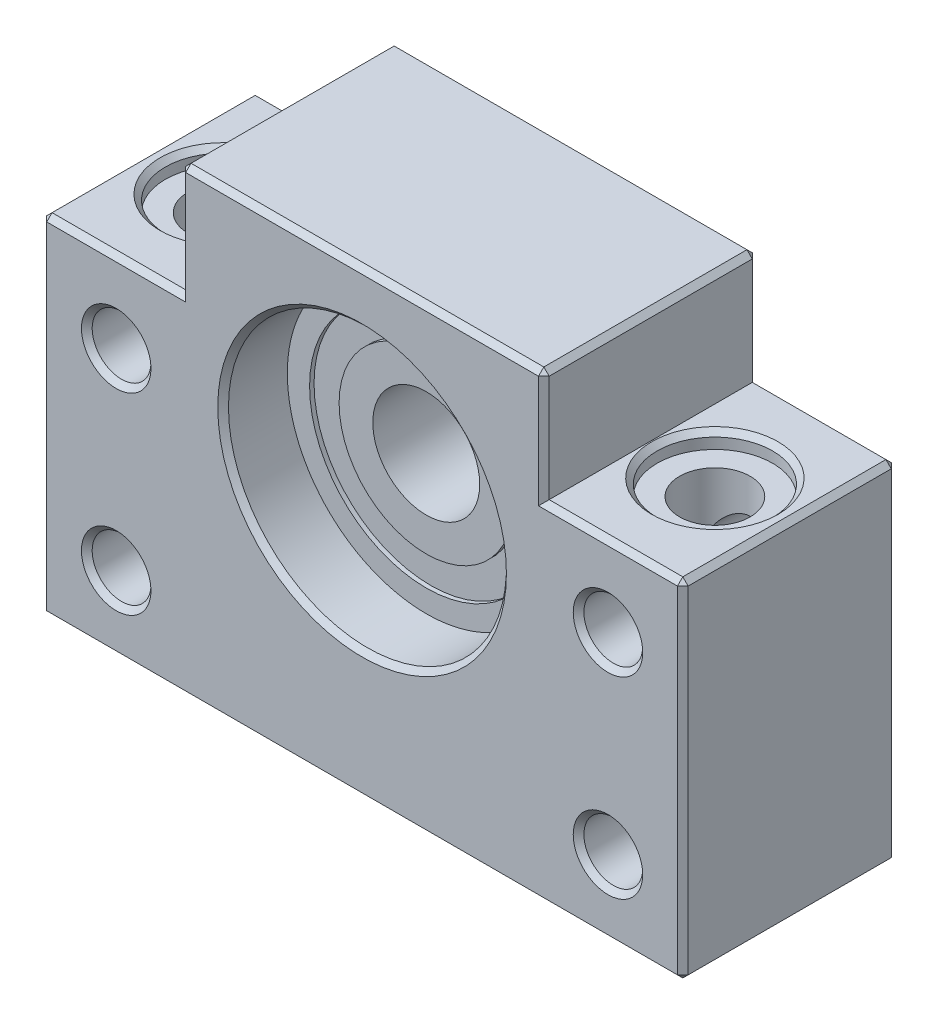
from build123d import *

# Parameters (mm, degrees)
SKETCH1_R           = 13
BOSS_EXTRUDE1_DEPTH = 10
SKETCH2_R           = 2.75
CUT_EXTRUDE1_DEPTH  = 44.874821937
SKETCH3_R           = 3.3
CUT_EXTRUDE2_DEPTH  = 46.345892868
SKETCH4_R           = 5.4
CUT_EXTRUDE3_DEPTH  = 1.5
CHAMFER1_SIZE       = 0.5


with BuildPart() as part:
    # Sketch1 → Boss-Extrude1 (new, symmetric)
    with BuildSketch(Plane.XY):
        Polygon((17, 18), (-17, 18), (-17, 7.5), (-30, 7.5), (-30, -25), (30, -25), (30, 7.5), (17, 7.5), align=None)
        Circle(SKETCH1_R, mode=Mode.SUBTRACT)
    extrude(amount=BOSS_EXTRUDE1_DEPTH, both=True)

    # Sketch2 → Cut-Extrude1 (cut, through all)
    with BuildSketch(Plane.XY.offset(10)):
        with Locations((-23, 0)):
            Circle(SKETCH2_R)
        with Locations((-23, -18)):
            Circle(SKETCH2_R)
        with Locations((23, -18)):
            Circle(SKETCH2_R)
        with Locations((23, 0)):
            Circle(SKETCH2_R)
    extrude(amount=-CUT_EXTRUDE1_DEPTH, mode=Mode.SUBTRACT)

    # Sketch3 → Cut-Extrude2 (cut, through all)
    with BuildSketch(Plane(origin=(0, 7.5, 0), x_dir=(1, 0, 0), z_dir=(0, 1, 0))):
        with Locations((-23, 0)):
            Circle(SKETCH3_R)
        with Locations((23, 0)):
            Circle(SKETCH3_R)
    extrude(amount=-CUT_EXTRUDE2_DEPTH, mode=Mode.SUBTRACT)

    # Sketch4 → Cut-Extrude3 (cut)
    with BuildSketch(Plane(origin=(0, 7.5, 0), x_dir=(1, 0, 0), z_dir=(0, 1, 0))):
        with Locations((-23, 0)):
            Circle(SKETCH4_R)
        with Locations((23, 0)):
            Circle(SKETCH4_R)
    extrude(amount=-CUT_EXTRUDE3_DEPTH, mode=Mode.SUBTRACT)

    # Chamfer1
    chamfer1_edges = [part.edges().sort_by_distance(p)[0] for p in [
        (-13, 0, -10),
        (-25.75, 0, -10),
        (20.25, 0, -10),
        (20.25, -18, -10),
        (-25.75, -18, -10),
        (-13, 0, 10),
        (30, -25, 0),
        (30, 7.5, 0),
        (17, 18, 0),
        (-17, 18, 0),
        (-30, 7.5, 0),
        (-23.5, 7.5, -10),
        (-30, -8.75, -10),
        (-17, 12.75, -10),
        (0, 18, -10),
        (17, 12.75, -10),
        (23.5, 7.5, -10),
        (30, -8.75, -10),
        (0, -25, -10),
        (-30, -25, 0),
        (0, 18, 10),
        (17, 12.75, 10),
        (23.5, 7.5, 10),
        (30, -8.75, 10),
        (0, -25, 10),
        (-30, -8.75, 10),
        (-23.5, 7.5, 10),
        (-17, 12.75, 10),
        (-25.75, 0, 10),
        (20.25, 0, 10),
        (20.25, -18, 10),
        (-25.75, -18, 10),
        (17.6, 7.5, 0),
        (-28.4, 7.5, 0),
    ]]
    chamfer(chamfer1_edges, length=CHAMFER1_SIZE)


with BuildPart() as body_2:
    # Sketch5 → Revolve1 (revolve)
    with BuildSketch(Plane(origin=(0, 0, 0), x_dir=(1, 0, 0), z_dir=(0, 1, 0))):
        Polygon((-13, 4), (-10.911412894, 4), (-10.911412894, 3.582423173), (-8.151084393, 3.582423173), (-8.151084393, 4), (-5, 4), (-5, 0), (-13, 0), align=None)
    revolve(axis=Axis((0, 0, 0), (0, 0, -1)))

    # Mirror2: body 2 across plane


with BuildPart() as body_2_1:
    add(body_2.part)
    add(body_2.part.mirror(Plane(origin=(-13, 0, 0), x_dir=(1, 0, 0), z_dir=(0, 0, -1))))


solid = Compound([part.part, body_2_1.part])
